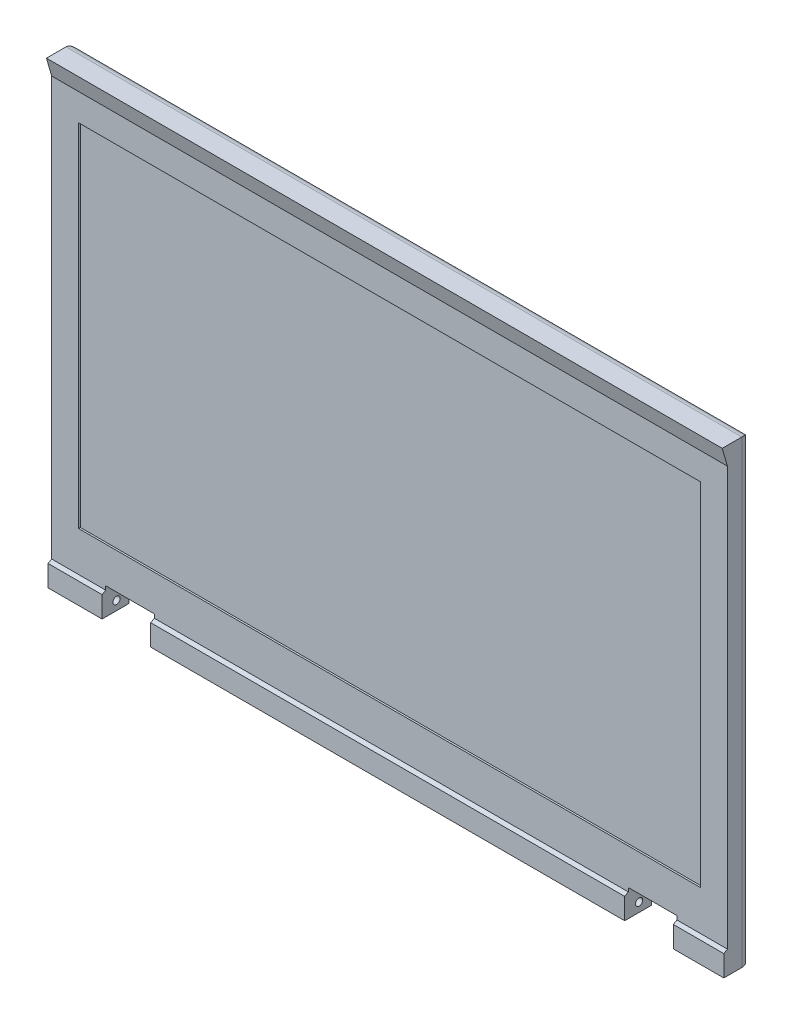
from build123d import *

# Parameters (mm, degrees)
BOSS_EXTRUDE1_DEPTH     = 375
SKETCH2_W               = 345
SKETCH2_H               = 195
CUT_EXTRUDE1_DEPTH      = 1
CHAMFER1_SIZE           = 5
CHAMFER1_SIZE_2         = 2.886751346
SKETCH3_W               = 27
SKETCH3_H               = 15
CUT_EXTRUDE2_DEPTH      = 30
CUT_EXTRUDE3_DEPTH      = 40
CUT_EXTRUDE3_DEPTH_BACK = 300
SKETCH4_R               = 2
BOSS_EXTRUDE2_DEPTH     = 375
FILLET1_R               = 5


with BuildPart() as part:
    # Sketch1 → Boss-Extrude1 (new body)
    with BuildSketch(Plane(origin=(0, 0, 0), x_dir=(0, 0, -1), z_dir=(1, 0, 0))):
        Polygon((0, 0), (-13, 0), (-15, 0), (-15, 10), (-13, 10), (-13, 255), (0, 255), align=None)
    extrude(amount=BOSS_EXTRUDE1_DEPTH)

    # Sketch2 → Cut-Extrude1 (cut)
    with BuildSketch(Plane.XY.offset(13)):
        with Locations((187.5, 132.5)):
            Rectangle(SKETCH2_W, SKETCH2_H)
    extrude(amount=-CUT_EXTRUDE1_DEPTH, mode=Mode.SUBTRACT)

    # Chamfer1
    # the kernel refuses this chamfer: 5, 2.886751346 mm, written as the material it adds along each edge
    with BuildSketch(Plane(origin=(0, 10, 13), x_dir=(0, -0.01932676561270064, 0.9998132206222079), z_dir=(1, 0, 0))) as chamfer1_piece_1_section:
        Polygon((CHAMFER1_SIZE * 0.999813220622, -CHAMFER1_SIZE * 0.0193267656127), (-CHAMFER1_SIZE_2 * 0.0193267656124, -CHAMFER1_SIZE_2 * 0.999813220604), (0, 0), align=None)
    chamfer1_piece_1 = extrude(amount=375, mode=Mode.PRIVATE)
    chamfer1_piece_1 = split(chamfer1_piece_1, bisect_by=Plane(origin=(187.5, 11.179939158, 15), z_dir=(0, 0, -1)), keep=Keep.TOP, mode=Mode.PRIVATE)
    add(chamfer1_piece_1)

    # Sketch3 → Cut-Extrude2 (cut)
    with BuildSketch(Plane.XY.offset(15)):
        with Locations((43.5, 7.5)):
            Rectangle(SKETCH3_W, SKETCH3_H)
        with Locations((333.5, 7.5)):
            Rectangle(SKETCH3_W, SKETCH3_H)
    extrude(amount=-CUT_EXTRUDE2_DEPTH, mode=Mode.SUBTRACT)

    # Sketch4 → Cut-Extrude3 (cut, two sides: drawn at the far end of the back side and taken through both)
    with BuildSketch(Plane.ZY.offset(-57).offset(-CUT_EXTRUDE3_DEPTH_BACK)):
        with Locations(Location((7, 5, 0), (0, 0, 180))):
            Circle(SKETCH4_R)
    extrude(amount=CUT_EXTRUDE3_DEPTH + CUT_EXTRUDE3_DEPTH_BACK, mode=Mode.SUBTRACT)

    # Sketch5 → Boss-Extrude2 (add)
    with BuildSketch(Plane(origin=(375, 0, 0), x_dir=(0, 0, -1), z_dir=(1, 0, 0))):
        Polygon((-13, 245), (-15.867453858, 255), (-13, 255), align=None)
    extrude(amount=-BOSS_EXTRUDE2_DEPTH)

    # Fillet1
    fillet1_edges = [part.edges().sort_by_distance(p)[0] for p in [
        (187.5, 255, 0),
        (375, 127.5, 0),
        (0, 127.5, 0),
    ]]
    fillet(fillet1_edges, radius=FILLET1_R)


solid = part.part
